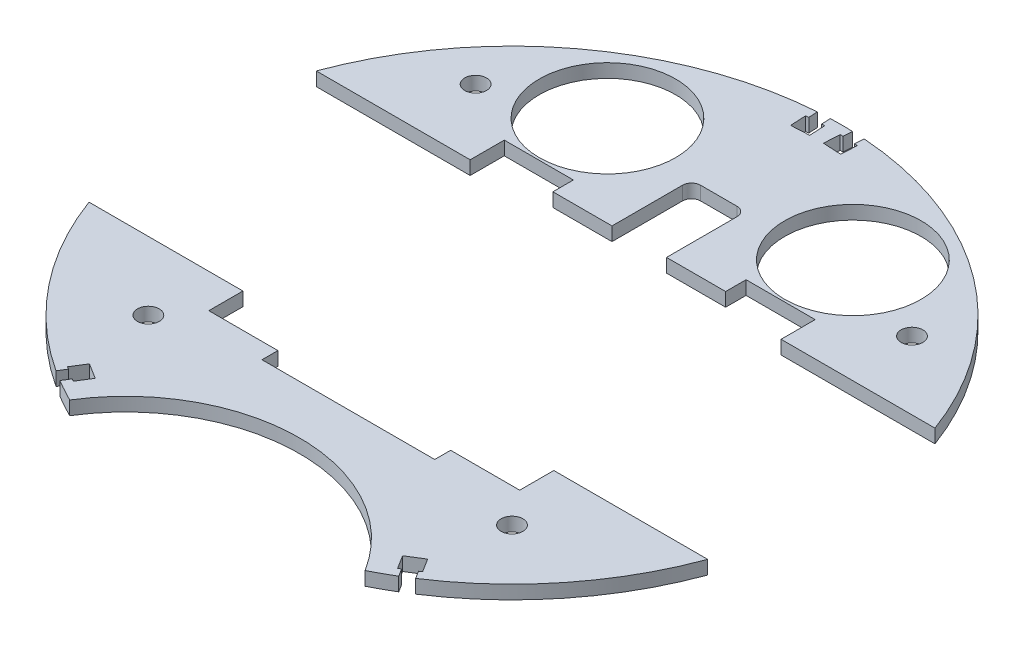
from build123d import *

# Parameters (mm, degrees)
BOSS_EXTRUDE1_DEPTH  = 3
SOLENOID_PLACEMENT_W = 38
SOLENOID_PLACEMENT_H = 64
CUT_EXTRUDE1_DEPTH   = 103.574363269
SKETCH7_R            = 15
CUT_EXTRUDE6_DEPTH   = 103.574363269
SKETCH8_R            = 2.4
CUT_EXTRUDE7_DEPTH   = 103.574363269
CUT_EXTRUDE3_DEPTH   = 103.574363269
CUT_EXTRUDE8_DEPTH   = 100.481153994
CUT_EXTRUDE9_DEPTH   = 100.481153994


with BuildPart() as part:
    # Sketch1 → Boss-Extrude1 (new body)
    with BuildSketch(Plane(origin=(0, 0, 0), x_dir=(1, 0, 0), z_dir=(0, 1, 0))):
        with BuildLine():
            ThreePointArc((32.48910875, -64.812867647), (0, 72.5), (-32.48910875, -64.812867647))
            ThreePointArc((-32.48910875, -64.812867647), (0, -46.75), (32.48910875, -64.812867647))
        make_face()
    extrude(amount=BOSS_EXTRUDE1_DEPTH)

    # solenoid placement → Cut-Extrude1 (cut, through all)
    with BuildSketch(Plane(origin=(0, 3, 0), x_dir=(1, 0, 0), z_dir=(0, 1, 0))):
        with Locations((0, -4)):
            Rectangle(SOLENOID_PLACEMENT_W, SOLENOID_PLACEMENT_H)
    extrude(amount=-CUT_EXTRUDE1_DEPTH, mode=Mode.SUBTRACT)

    # Sketch7 → Cut-Extrude6 (cut, through all)
    with BuildSketch(Plane(origin=(0, 3, 0), x_dir=(1, 0, 0), z_dir=(0, 1, 0))):
        with Locations((27, 48)):
            Circle(SKETCH7_R)
        with Locations((-27, 48)):
            Circle(SKETCH7_R)
    extrude(amount=-CUT_EXTRUDE6_DEPTH, mode=Mode.SUBTRACT)

    # Sketch8 → Cut-Extrude7 (cut, through all)
    with BuildSketch(Plane(origin=(0, 3, 0), x_dir=(1, 0, 0), z_dir=(0, 1, 0))):
        with Locations((40, -40)):
            Circle(SKETCH8_R)
        with Locations((-40, -40)):
            Circle(SKETCH8_R)
        with Locations((48, 40)):
            Circle(SKETCH8_R)
        with Locations((-48, 40)):
            Circle(SKETCH8_R)
    extrude(amount=-CUT_EXTRUDE7_DEPTH, mode=Mode.SUBTRACT)

    # Sketch3 → Cut-Extrude3 (cut, through all)
    with BuildSketch(Plane(origin=(0, 3, 0), x_dir=(1, 0, 0), z_dir=(0, 1, 0))):
        with BuildLine():
            Line((-34.2, -32.5), (-22.2, -32.5))
            Line((-22.2, -32.5), (-19, -32.5))
            Line((-19, -32.5), (-19, 32.5))
            Line((-19, 32.5), (-22.2, 32.5))
            Line((-22.2, 32.5), (-34.2, 32.5))
            Line((-34.2, 32.5), (-34.2, 25))
            Line((-34.2, 25), (-68.053287944, 25))
            ThreePointArc((-68.053287944, 25), (-72.5, 0), (-68.053287944, -25))
            Line((-68.053287944, -25), (-34.2, -25))
            Line((-34.2, -25), (-34.2, -32.5))
        make_face()
        with BuildLine():
            Line((19, 32.5), (19, -32.5))
            Line((19, -32.5), (22.2, -32.5))
            Line((22.2, -32.5), (34.2, -32.5))
            Line((34.2, -32.5), (34.2, -25))
            Line((34.2, -25), (68.053287944, -25))
            ThreePointArc((68.053287944, -25), (72.5, 0), (68.053287944, 25))
            Line((68.053287944, 25), (34.2, 25))
            Line((34.2, 25), (34.2, 32.5))
            Line((34.2, 32.5), (22.2, 32.5))
            Line((22.2, 32.5), (19, 32.5))
        make_face()
    extrude(amount=-CUT_EXTRUDE3_DEPTH, mode=Mode.SUBTRACT)


with BuildPart() as cut_extrude3_piece_1:
    # of the separate pieces the step leaves, piece 1, a body of its own (cut_extrude3_pieces)
    add(part.part.solids().sort_by_distance((68.053287944, 0, -25))[0])

    # Sketch9 → Cut-Extrude8 (cut, through all)
    with BuildSketch(Plane(origin=(0, 3, 0), x_dir=(1, 0, 0), z_dir=(0, 1, 0))):
        with BuildLine():
            Line((6, 43.5), (6, 28))
            Line((6, 28), (-6, 28))
            Line((-6, 28), (-6, 43.5))
            ThreePointArc((-6, 43.5), (-5.414213562, 44.914213562), (-4, 45.5))
            Line((-4, 45.5), (4, 45.5))
            ThreePointArc((4, 45.5), (5.414213562, 44.914213562), (6, 43.5))
        make_face()
    extrude(amount=-CUT_EXTRUDE8_DEPTH, mode=Mode.SUBTRACT)


with BuildPart() as cut_extrude3_piece_2:
    # of the separate pieces the step leaves, piece 2, a body of its own (cut_extrude3_pieces)
    add(part.part.solids().sort_by_distance((32.48910875, 0, 64.812867647))[0])


with BuildPart() as cut_extrude9_tool:
    # Sketch10 → Cut-Extrude9 (new, through all)
    with BuildSketch(Plane(origin=(0, 3, 0), x_dir=(1, 0, 0), z_dir=(0, 1, 0))):
        Polygon((1.509249999, 67.012850741), (5.503768138, 66.803506916), (5.686943985, 70.298710288), (5.037834787, 70.332728659), (5.1425067, 72.329987729), (2.446206956, 72.471294811), (2.341535043, 70.474035741), (1.692425846, 70.508054113), align=None)
        Polygon((-5.037834787, 70.332728659), (-5.686943985, 70.298710288), (-5.503768138, 66.803506916), (-1.509249999, 67.012850741), (-1.692425846, 70.508054113), (-2.341535043, 70.474035741), (-2.446206956, 72.471294811), (-5.1425067, 72.329987729), align=None)
        Polygon((37.200686896, -55.759383914), (33.808494511, -57.879060971), (35.663211936, -60.847229307), (36.214443199, -60.502781786), (37.274281727, -62.198877978), (39.564011587, -60.768095965), (38.504173058, -59.071999772), (39.055404321, -58.727552251), align=None)
        Polygon((-33.808494511, -57.879060971), (-37.200686896, -55.759383914), (-39.055404321, -58.727552251), (-38.504173058, -59.071999772), (-39.564011587, -60.768095965), (-37.274281727, -62.198877978), (-36.214443199, -60.502781786), (-35.663211936, -60.847229307), align=None)
    extrude(amount=-CUT_EXTRUDE9_DEPTH)


with BuildPart() as cut_extrude3_piece_1_1:
    add(cut_extrude3_piece_1.part)

    # Cut-Extrude9: cut by cut_extrude9_tool
    add(cut_extrude9_tool.part, mode=Mode.SUBTRACT)


with BuildPart() as cut_extrude3_piece_2_1:
    add(cut_extrude3_piece_2.part)

    # Cut-Extrude9: cut by cut_extrude9_tool
    add(cut_extrude9_tool.part, mode=Mode.SUBTRACT)


solid = Compound([cut_extrude3_piece_1_1.part, cut_extrude3_piece_2_1.part])
